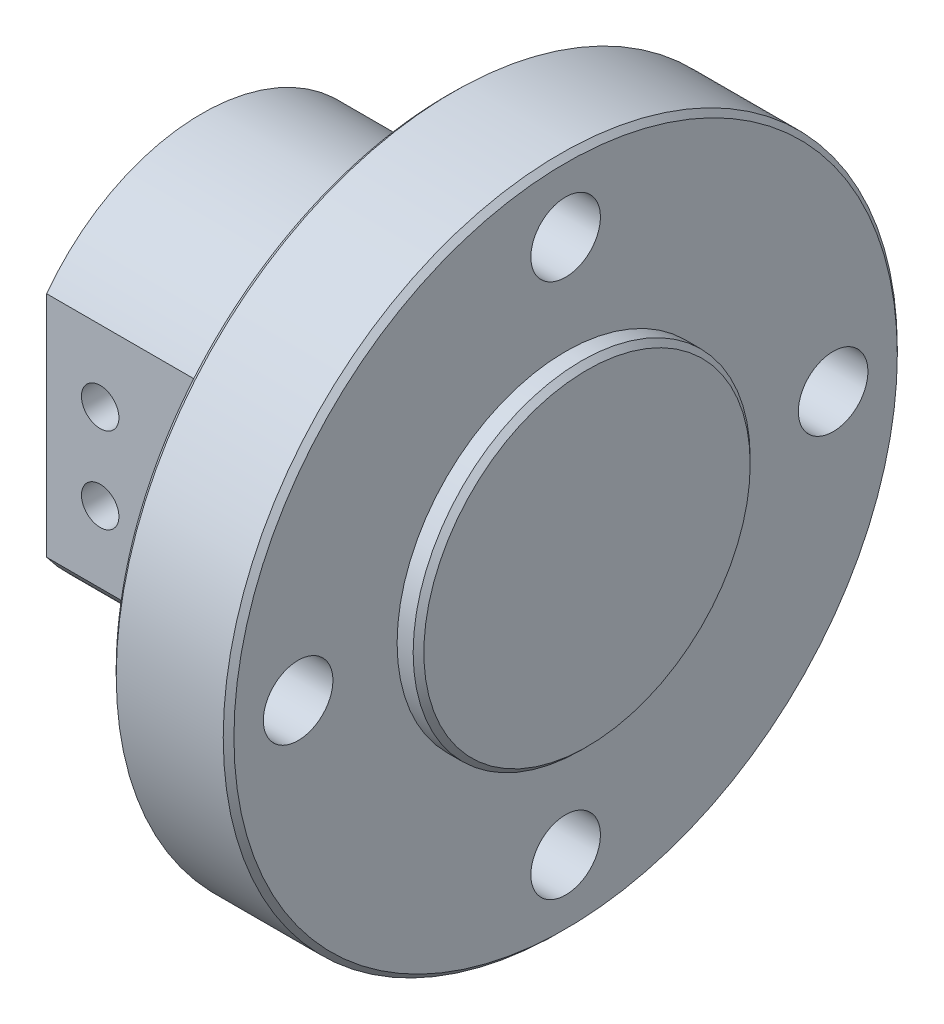
from build123d import *

# Parameters (mm, degrees)
SKETCH1_R           = 31.5
BOSS_EXTRUDE1_DEPTH = 11
SKETCH2_R           = 3.25
CUT_EXTRUDE1_DEPTH  = 46.885727629
SKETCH3_R           = 6
CUT_EXTRUDE2_DEPTH  = 5
CHAMFER1_SIZE       = 0.5
SKETCH4_R           = 15.75
BOSS_EXTRUDE2_DEPTH = 2
CHAMFER2_SIZE       = 0.5
SKETCH5_R           = 18
SKETCH5_R_2         = 10.5
BOSS_EXTRUDE3_DEPTH = 23
BOSS_EXTRUDE4_REACH = 59.276
CUT_EXTRUDE3_START  = -22
CUT_EXTRUDE3_DEPTH  = 22
SKETCH8_R           = 1.75
CUT_EXTRUDE4_DEPTH  = 61.309617807
CIRPATTERN1_COUNT   = 4


with BuildPart() as part:
    # Sketch1 → Boss-Extrude1 (new body)
    with BuildSketch(Plane(origin=(0, 0, 0), x_dir=(0, 0, -1), z_dir=(1, 0, 0))):
        Circle(SKETCH1_R)
    extrude(amount=BOSS_EXTRUDE1_DEPTH)

    # Sketch2 → Cut-Extrude1 (cut, through all)
    with BuildSketch(Plane.ZY):
        with Locations((0, 25)):
            Circle(SKETCH2_R)
        with Locations((0, -25)):
            Circle(SKETCH2_R)
    cut_extrude1 = extrude(amount=-CUT_EXTRUDE1_DEPTH, mode=Mode.SUBTRACT)

    # Sketch3 → Cut-Extrude2 (cut)
    with BuildSketch(Plane.ZY):
        with Locations((0, 25)):
            Circle(SKETCH3_R)
        with Locations((0, -25)):
            Circle(SKETCH3_R)
    cut_extrude2 = extrude(amount=-CUT_EXTRUDE2_DEPTH, mode=Mode.SUBTRACT)

    # Chamfer1
    chamfer1_edges = [part.edges().sort_by_distance(p)[0] for p in [
        (0, 0, 31.5),
        (11, 0, 31.5),
    ]]
    chamfer(chamfer1_edges, length=CHAMFER1_SIZE - 0.0001)  # a hair under: the kernel refuses the full size

    # Sketch4 → Boss-Extrude2 (add)
    with BuildSketch(Plane(origin=(11, 0, 0), x_dir=(0, 0, -1), z_dir=(1, 0, 0))):
        Circle(SKETCH4_R)
    extrude(amount=BOSS_EXTRUDE2_DEPTH)

    # Chamfer2
    chamfer2_edges = [part.edges().sort_by_distance(p)[0] for p in [
        (13, 0, 15.75),
    ]]
    chamfer(chamfer2_edges, length=CHAMFER2_SIZE)

    # Sketch5 → Boss-Extrude3 (add)
    with BuildSketch(Plane.ZY):
        Circle(SKETCH5_R)
        Circle(SKETCH5_R_2, mode=Mode.SUBTRACT)
    extrude(amount=BOSS_EXTRUDE3_DEPTH)

    # Sketch6 → Boss-Extrude4 (add, up to next)
    with BuildSketch(Plane.ZY.offset(23), mode=Mode.PRIVATE) as boss_extrude4_sk1:
        with BuildLine():
            ThreePointArc((10.5, 0), (9.987492178, 3.240370349), (8.5, 6.164414003))
            Line((8.5, 6.164414003), (8.5, -6.164414003))
            ThreePointArc((8.5, -6.164414003), (9.987492178, -3.240370349), (10.5, 0))
        make_face()
    boss_extrude4_tool1 = extrude(boss_extrude4_sk1.sketch, amount=-BOSS_EXTRUDE4_REACH, mode=Mode.PRIVATE) - part.part
    # Sketch6 → Boss-Extrude4 (add, up to next)
    with BuildSketch(Plane.ZY.offset(23), mode=Mode.PRIVATE) as boss_extrude4_sk2:
        with BuildLine():
            Line((-8.5, -6.164414003), (-8.5, 6.164414003))
            ThreePointArc((-8.5, 6.164414003), (-10.5, 0), (-8.5, -6.164414003))
        make_face()
    boss_extrude4_tool2 = extrude(boss_extrude4_sk2.sketch, amount=-BOSS_EXTRUDE4_REACH, mode=Mode.PRIVATE) - part.part
    add(boss_extrude4_tool1.solids().sort_by_distance((-23, 0, 9.306913))[0])
    add(boss_extrude4_tool2.solids().sort_by_distance((-23, 0, -9.306913))[0])

    # Sketch7 → Cut-Extrude3 (cut)
    with BuildSketch(Plane.ZY.offset(23).offset(CUT_EXTRUDE3_START)):
        with BuildLine():
            ThreePointArc((18, 0), (17.102631376, 5.61248608), (14.5, 10.665364504))
            Line((14.5, 10.665364504), (14.5, -10.665364504))
            ThreePointArc((14.5, -10.665364504), (17.102631376, -5.61248608), (18, 0))
        make_face()
        with BuildLine():
            Line((-14.5, -10.665364504), (-14.5, 10.665364504))
            ThreePointArc((-14.5, 10.665364504), (-18, 0), (-14.5, -10.665364504))
        make_face()
    extrude(amount=CUT_EXTRUDE3_DEPTH, mode=Mode.SUBTRACT)

    # Sketch8 → Cut-Extrude4 (cut, through all)
    with BuildSketch(Plane.XY.offset(14.5)):
        with Locations((-18, 4)):
            Circle(SKETCH8_R)
        with Locations((-6, 4)):
            Circle(SKETCH8_R)
        with Locations((-6, -4)):
            Circle(SKETCH8_R)
        with Locations((-18, -4)):
            Circle(SKETCH8_R)
    extrude(amount=-CUT_EXTRUDE4_DEPTH, mode=Mode.SUBTRACT)

    # CirPattern1: Cut-Extrude1, Cut-Extrude2 ×4 about axis
    cirpattern1_axis = Axis((0, 0, 0), (1, 0, 0))
    add([cut_extrude1.rotate(cirpattern1_axis, i * 360 / CIRPATTERN1_COUNT) for i in range(1, CIRPATTERN1_COUNT)], mode=Mode.SUBTRACT)
    add([cut_extrude2.rotate(cirpattern1_axis, i * 360 / CIRPATTERN1_COUNT) for i in range(1, CIRPATTERN1_COUNT)], mode=Mode.SUBTRACT)


solid = part.part
